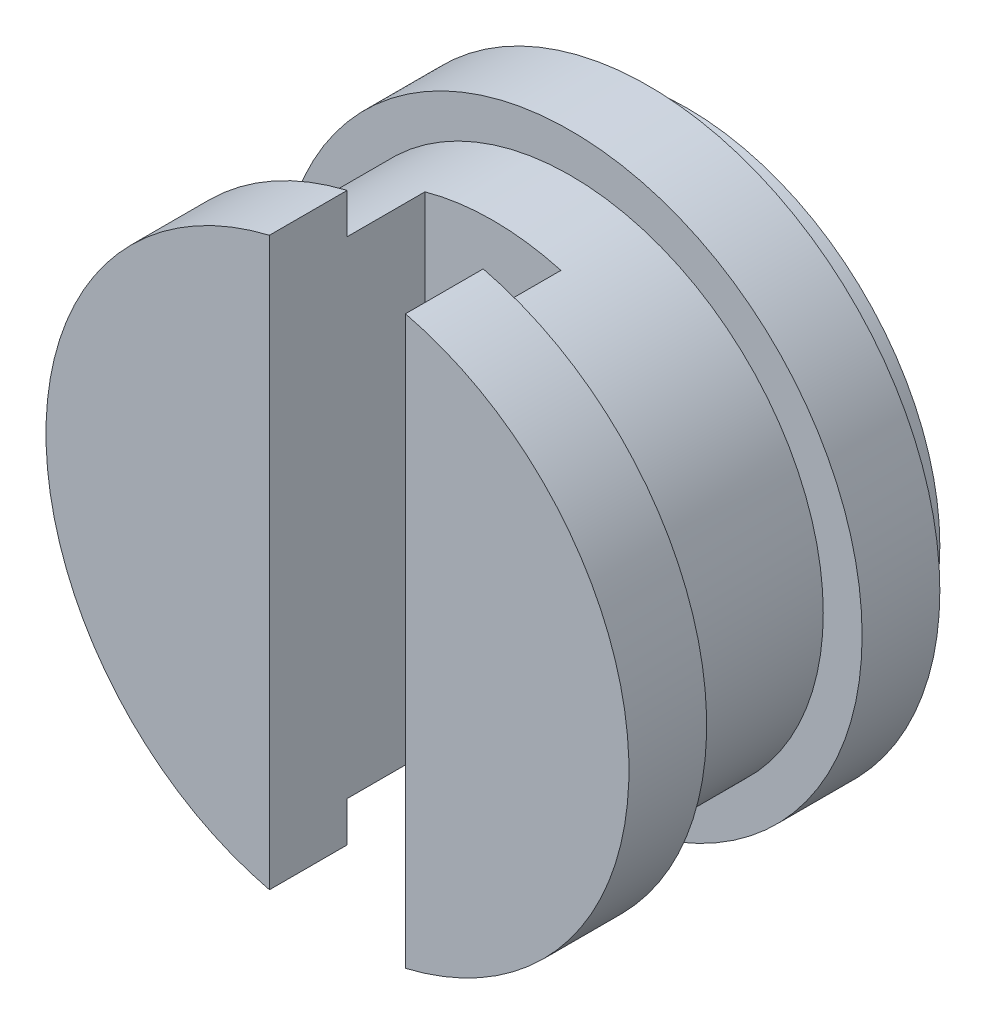
from build123d import *

# Parameters (mm, degrees)
SKETCH_1_R          = 13
EXTRUDE_1_DEPTH     = 16
EXTRUDE_START       = 2
SKETCH_2_R          = 15
EXTRUDE_2_DEPTH     = 4
SKETCH_3_W          = 15
SKETCH_3_H          = 5
CUT_EXTRUDE_1_DEPTH = 8
SKETCH_4_R          = 11
CUT_EXTRUDE_2_DEPTH = 6
EXTRUDE_START_2     = 14
SKETCH_5_R          = 15
EXTRUDE_3_DEPTH     = 4
CUT_EXTRUDE_START   = 10
SKETCH_6_W          = 7
SKETCH_6_H          = 32
CUT_EXTRUDE_3_DEPTH = 8


with BuildPart() as part:
    # Эскиз1 → Бобышка-Вытянуть1 (new body)
    with BuildSketch(Plane.XY):
        Circle(SKETCH_1_R)
    extrude(amount=EXTRUDE_1_DEPTH)

    # Эскиз2 → Бобышка-Вытянуть2 (add)
    with BuildSketch(Plane.XY.offset(EXTRUDE_START)):
        Circle(SKETCH_2_R)
    extrude(amount=EXTRUDE_2_DEPTH)

    # Эскиз3 → Вырез-Вытянуть1 (cut)
    with BuildSketch(Plane.XY):
        Rectangle(SKETCH_3_W, SKETCH_3_H)
    extrude(amount=CUT_EXTRUDE_1_DEPTH, mode=Mode.SUBTRACT)

    # Эскиз4 → Вырез-Вытянуть2 (cut)
    with BuildSketch(Plane.XY):
        Circle(SKETCH_4_R)
    extrude(amount=CUT_EXTRUDE_2_DEPTH, mode=Mode.SUBTRACT)

    # Эскиз5 → Бобышка-Вытянуть3 (add)
    with BuildSketch(Plane.XY.offset(EXTRUDE_START_2)):
        Circle(SKETCH_5_R)
    extrude(amount=EXTRUDE_3_DEPTH)

    # Эскиз6 → Вырез-Вытянуть3 (cut)
    with BuildSketch(Plane.XY.offset(CUT_EXTRUDE_START)):
        Rectangle(SKETCH_6_W, SKETCH_6_H)
    extrude(amount=CUT_EXTRUDE_3_DEPTH, mode=Mode.SUBTRACT)


solid = part.part
